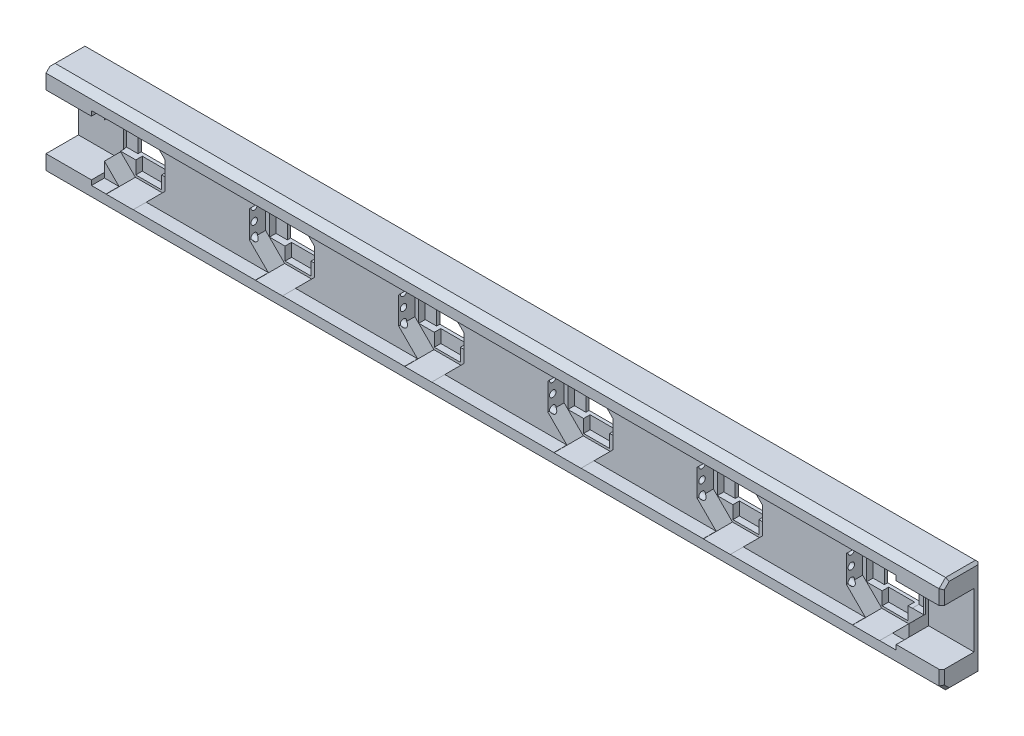
from build123d import *

# Parameters (mm, degrees)
SKETCH1_W                = 138
SKETCH1_H                = 15
BOSS_EXTRUDE1_DEPTH      = 6
CUT_EXTRUDE8_DEPTH       = 138
SKETCH13_W               = 0.5
SKETCH13_H               = 10
CUT_EXTRUDE9_DEPTH       = 0.6
FILLET1_R                = 0.25
FILLET2_R                = 0.25
CHAMFER1_SIZE            = 0.4
CHAMFER2_SIZE            = 0.4
CHAMFER3_SIZE            = 0.4
CHAMFER5_SIZE            = 0.4
CUT_EXTRUDE10_DEPTH      = 4.5
SKETCH16_W               = 5.3
SKETCH16_H               = 5.3
CUT_EXTRUDE11_DEPTH      = 4.5
SKETCH17_W               = 4
SKETCH17_H               = 2
CUT_EXTRUDE12_DEPTH      = 1
SKETCH18_W               = 1.75
SKETCH18_H               = 5.318073247
SKETCH18_H_2             = 5.281926753
CUT_EXTRUDE13_DEPTH      = 1
LPATTERN1_COUNT          = 6
LPATTERN1_PITCH          = 23
SKETCH19_W               = 7
SKETCH19_H               = 8.5
CUT_EXTRUDE14_DEPTH      = 5
SKETCH20_W               = 124
SKETCH20_H               = 10
CUT_EXTRUDE15_DEPTH      = 2
CUT_EXTRUDE16_DEPTH      = 80.806458515
CUT_EXTRUDE16_DEPTH_BACK = 80.806458515
SKETCH21_R               = 0.5


with BuildPart() as part:
    # Sketch1 → Boss-Extrude1 (new body)
    with BuildSketch(Plane.XY):
        with Locations((-22.75, 18.154296875)):
            Rectangle(SKETCH1_W, SKETCH1_H)
    extrude(amount=BOSS_EXTRUDE1_DEPTH)

    # Sketch12 → Cut-Extrude8 (cut)
    with BuildSketch(Plane(origin=(46.25, 0, 0), x_dir=(0, 0, -1), z_dir=(1, 0, 0))):
        Polygon((-6, 25.654296875), (-6, 24.654296875), (-5, 25.654296875), align=None)
        Polygon((-6, 10.654296875), (-5, 10.654296875), (-6, 11.654296875), align=None)
    extrude(amount=-CUT_EXTRUDE8_DEPTH, mode=Mode.SUBTRACT)

    # Sketch13 → Cut-Extrude9 (cut)
    with BuildSketch(Plane(origin=(0, 0, 0), x_dir=(-1, 0, 0), z_dir=(0, 0, -1))):
        with Locations((89.5, 18.154296875)):
            Rectangle(SKETCH13_W, SKETCH13_H)
    extrude(amount=-CUT_EXTRUDE9_DEPTH, mode=Mode.SUBTRACT)

    # Fillet1
    fillet1_edges = [part.edges().sort_by_distance(p)[0] for p in [
        (-89.75, 18.154296875, 0),
    ]]
    fillet(fillet1_edges, radius=FILLET1_R)

    # Fillet2
    fillet2_edges = [part.edges().sort_by_distance(p)[0] for p in [
        (-89.25, 18.154296875, 0.6),
        (-89.5, 23.154296875, 0.6),
        (-89.75, 18.154296875, 0.6),
        (-89.5, 13.154296875, 0.6),
    ]]
    fillet(fillet2_edges, radius=FILLET2_R - 0.0001)  # a hair under: the kernel refuses the full size

    # Chamfer1
    chamfer1_edges = [part.edges().sort_by_distance(p)[0] for p in [
        (-22.75, 25.654296875, 0),
        (-22.75, 10.654296875, 0),
    ]]
    chamfer(chamfer1_edges, length=CHAMFER1_SIZE)

    # Chamfer2
    chamfer2_edges = [part.edges().sort_by_distance(p)[0] for p in [
        (46.25, 18.154296875, 0),
        (-91.75, 18.154296875, 0),
    ]]
    chamfer(chamfer2_edges, length=CHAMFER2_SIZE)

    # Chamfer3
    chamfer3_edges = [part.edges().sort_by_distance(p)[0] for p in [
        (-91.75, 25.654296875, 2.7),
        (-91.75, 10.654296875, 2.7),
    ]]
    chamfer(chamfer3_edges, length=CHAMFER3_SIZE)

    # Chamfer5
    chamfer5_edges = [part.edges().sort_by_distance(p)[0] for p in [
        (46.25, 18.154296875, 6),
        (46.25, 25.654296875, 2.7),
        (46.25, 10.654296875, 2.7),
        (46.25, 25.154296875, 5.5),
        (46.25, 11.154296875, 5.5),
    ]]
    chamfer(chamfer5_edges, length=CHAMFER5_SIZE)

    # Sketch15 → Cut-Extrude10 (cut)
    with BuildSketch(Plane.XY.offset(6)):
        Polygon((-75.382117138, 20.232772011), (-78.321524864, 23.172179737), (-82.478475136, 23.172179737), (-85.417882862, 20.232772011), (-85.417882862, 16.075821739), (-82.478475136, 13.136414013), (-78.321524864, 13.136414013), (-75.382117138, 16.075821739), align=None)
    cut_extrude10 = extrude(amount=-CUT_EXTRUDE10_DEPTH, mode=Mode.SUBTRACT)

    # Sketch16 → Cut-Extrude11 (cut)
    with BuildSketch(Plane.XY.offset(1.5)):
        with Locations((-80.417882862, 18.136414013)):
            Rectangle(SKETCH16_W, SKETCH16_H)
    cut_extrude11 = extrude(amount=-CUT_EXTRUDE11_DEPTH, mode=Mode.SUBTRACT)

    # Sketch17 → Cut-Extrude12 (cut)
    with BuildSketch(Plane.XY.offset(1.5)):
        with Locations((-80.417882862, 14.486414013)):
            Rectangle(SKETCH17_W, SKETCH17_H)
        with Locations((-80.417882862, 21.786414013)):
            Rectangle(SKETCH17_W, SKETCH17_H)
    cut_extrude12 = extrude(amount=-CUT_EXTRUDE12_DEPTH, mode=Mode.SUBTRACT)

    # Sketch18 → Cut-Extrude13 (cut)
    with BuildSketch(Plane.XY.offset(1.5)):
        with Locations((-83.942882862, 18.145450637)):
            Rectangle(SKETCH18_W, SKETCH18_H)
        with Locations((-76.892882862, 18.145450637)):
            Rectangle(SKETCH18_W, SKETCH18_H_2)
    cut_extrude13 = extrude(amount=-CUT_EXTRUDE13_DEPTH, mode=Mode.SUBTRACT)

    # LPattern1: Cut-Extrude10, Cut-Extrude11, Cut-Extrude12, Cut-Extrude13 ×6
    with Locations(*[(i * LPATTERN1_PITCH, 0, 0) for i in range(1, LPATTERN1_COUNT)]):
        add(cut_extrude10, mode=Mode.SUBTRACT)
        add(cut_extrude11, mode=Mode.SUBTRACT)
        add(cut_extrude12, mode=Mode.SUBTRACT)
        add(cut_extrude13, mode=Mode.SUBTRACT)

    # Sketch19 → Cut-Extrude14 (cut)
    with BuildSketch(Plane.XY.offset(6)):
        with Locations((-88.25, 18.154296875)):
            Rectangle(SKETCH19_W, SKETCH19_H)
        with Locations((42.75, 18.154296875)):
            Rectangle(SKETCH19_W, SKETCH19_H)
    extrude(amount=-CUT_EXTRUDE14_DEPTH, mode=Mode.SUBTRACT)

    # Sketch20 → Cut-Extrude15 (cut)
    with BuildSketch(Plane.XY.offset(6)):
        with Locations((-22.75, 18.154296875)):
            Rectangle(SKETCH20_W, SKETCH20_H)
    extrude(amount=-CUT_EXTRUDE15_DEPTH, mode=Mode.SUBTRACT)

    # Sketch21 → Cut-Extrude16 (cut, two sides: drawn at the far end of the back side and taken through both)
    with BuildSketch(Plane(origin=(-16.417882862, 0, 0), x_dir=(0, 0, -1), z_dir=(1, 0, 0)).offset(-CUT_EXTRUDE16_DEPTH_BACK)):
        with Locations(Location((-3.25, 18.162772011, 0), (0, 0, 180))):
            Circle(SKETCH21_R)
        with Locations(Location((-3.25, 20.162772011, 0), (0, 0, 171.952153753))):
            Circle(SKETCH21_R)
        with Locations(Location((-3.25, 16.162772011, 0), (0, 0, 349.985317108))):
            Circle(SKETCH21_R)
    extrude(amount=CUT_EXTRUDE16_DEPTH + CUT_EXTRUDE16_DEPTH_BACK, mode=Mode.SUBTRACT)


solid = part.part
